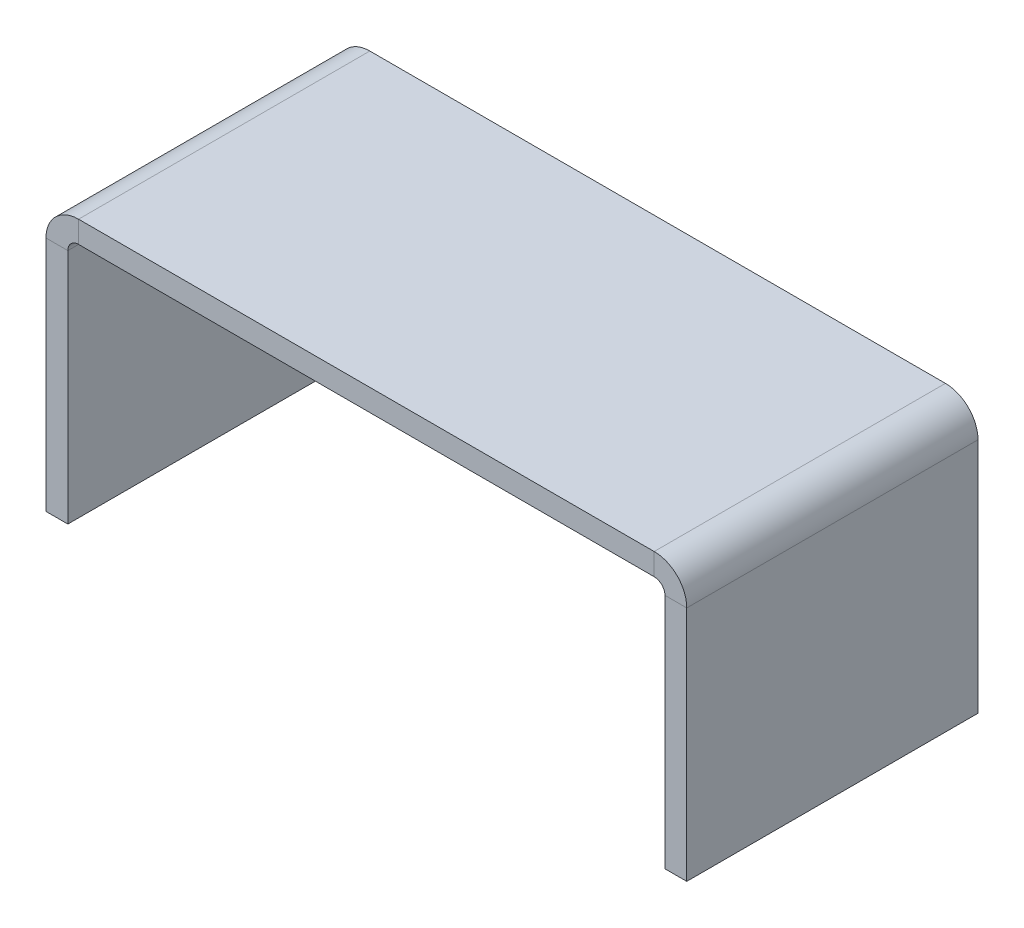
from build123d import *

# Parameters (mm, degrees)
CROQUIS2_W                         = 44
CROQUIS2_H                         = 20
BRIDA_BASE1_DEPTH                  = 1.5
BRIDA_DE_ARISTA1_STRIP_W           = 7.4732
BRIDA_DE_ARISTA1_STRIP_H           = 1.5
BRIDA_DE_ARISTA1_STRIP_CUT_DEPTH   = 20
BRIDA_DE_ARISTA1_STRIP_2_W         = 7.4732
BRIDA_DE_ARISTA1_STRIP_2_H         = 1.5
BRIDA_DE_ARISTA1_STRIP_CUT_2_DEPTH = 20
BRIDA_DE_ARISTA1_DEPTH             = 20
BRIDA_DE_ARISTA1_BEND_DEPTH        = 20


# Sheet-metal steps are written as plain solids
with BuildPart() as part:
    # Croquis2 → Brida base1 (new body)
    with BuildSketch(Plane(origin=(0, 0, 0), x_dir=(1, 0, 0), z_dir=(0, 1, 0))):
        Rectangle(CROQUIS2_W, CROQUIS2_H)
    extrude(amount=-BRIDA_BASE1_DEPTH)

    # Brida de arista1 strip (across the edge) → Brida de arista1 strip cut (cut)
    with BuildSketch(Plane(origin=(-22, -1.5, 10), x_dir=(1, 0, 0), z_dir=(0, 0, -1))):
        with Locations((-1.5, -0.75)):
            Rectangle(BRIDA_DE_ARISTA1_STRIP_W, BRIDA_DE_ARISTA1_STRIP_H)
    extrude(amount=BRIDA_DE_ARISTA1_STRIP_CUT_DEPTH, mode=Mode.SUBTRACT)

    # Brida de arista1 strip 2 (across the edge) → Brida de arista1 strip cut 2 (cut)
    with BuildSketch(Plane(origin=(22, -1.5, -10), x_dir=(-1, 0, 0), z_dir=(0, 0, 1))):
        with Locations((-1.5, -0.75)):
            Rectangle(BRIDA_DE_ARISTA1_STRIP_2_W, BRIDA_DE_ARISTA1_STRIP_2_H)
    extrude(amount=BRIDA_DE_ARISTA1_STRIP_CUT_2_DEPTH, mode=Mode.SUBTRACT)

    # Brida de arista1 section (across the edge) → Brida de arista1 (add)
    with BuildSketch(Plane(origin=(-22, -1.5, 10), x_dir=(1, 0, 0), z_dir=(0, 0, -1))):
        with BuildLine():
            Line((0, 0.7366), (0, 17))
            Line((0, 17), (1.5, 17))
            Line((1.5, 17), (1.5, 0.7366))
            ThreePointArc((1.5, 0.7366), (1.715745145, 0.215745145), (2.2366, 0))
            Line((2.2366, 0), (2.2366, -1.5))
            ThreePointArc((2.2366, -1.5), (0.655084973, -0.844915027), (0, 0.7366))
        make_face()
    extrude(amount=BRIDA_DE_ARISTA1_DEPTH)

    # Brida de arista1 section 2 (across the edge) → Brida de arista1 bend (add)
    with BuildSketch(Plane(origin=(22, -1.5, -10), x_dir=(-1, 0, 0), z_dir=(0, 0, 1))):
        with BuildLine():
            Line((0, 0.7366), (0, 17))
            Line((0, 17), (1.5, 17))
            Line((1.5, 17), (1.5, 0.7366))
            ThreePointArc((1.5, 0.7366), (1.715745145, 0.215745145), (2.2366, 0))
            Line((2.2366, 0), (2.2366, -1.5))
            ThreePointArc((2.2366, -1.5), (0.655084973, -0.844915027), (0, 0.7366))
        make_face()
    extrude(amount=BRIDA_DE_ARISTA1_BEND_DEPTH)


solid = part.part
